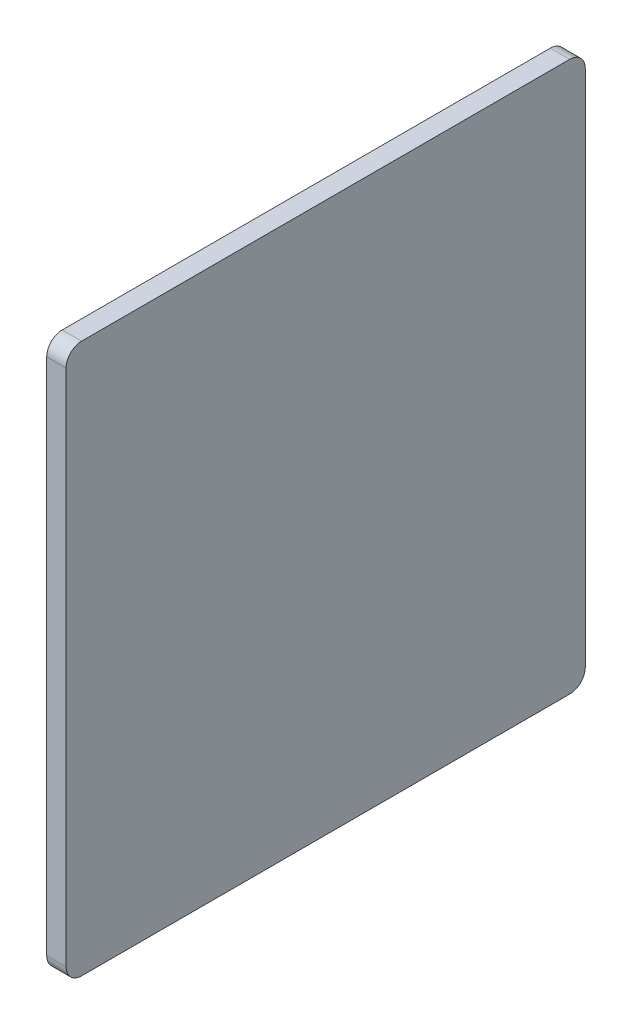
from build123d import *

# Parameters (mm, degrees)
SKETCH1_W           = 84.999999926
SKETCH1_H           = 90
BOSS_EXTRUDE1_DEPTH = 3.175
FILLET1_R           = 2.54


with BuildPart() as part:
    # Sketch1 → Boss-Extrude1 (new body)
    with BuildSketch(Plane(origin=(0, 0, 0), x_dir=(0, 0, -1), z_dir=(1, 0, 0))):
        Rectangle(SKETCH1_W, SKETCH1_H)
    extrude(amount=BOSS_EXTRUDE1_DEPTH)

    # Fillet1
    fillet1_edges = [part.edges().sort_by_distance(p)[0] for p in [
        (1.5875, -45, 42.499999963),
        (1.5875, -45, -42.499999963),
        (1.5875, 45, -42.499999963),
        (1.5875, 45, 42.499999963),
    ]]
    fillet(fillet1_edges, radius=FILLET1_R)


solid = part.part
